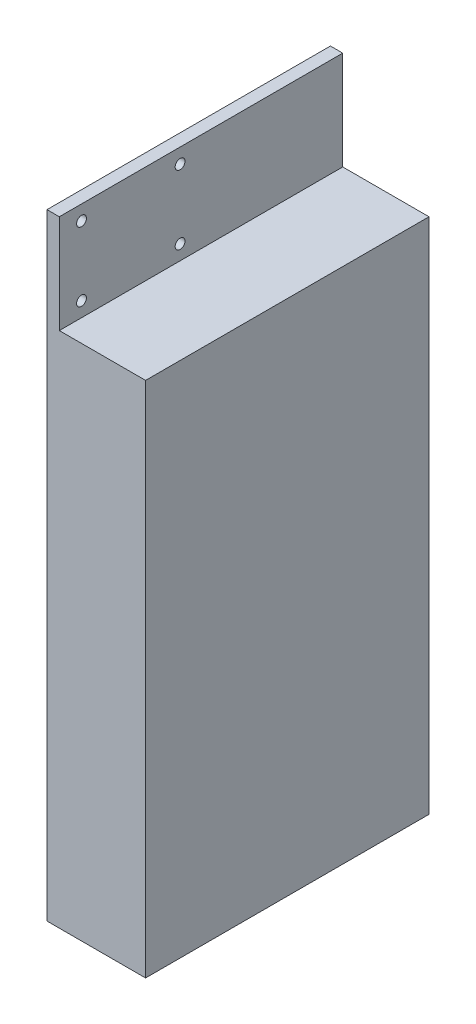
from build123d import *

# Parameters (mm, degrees)
BOSS_EXTRUDE1_DEPTH = 115
SKETCH2_R           = 2
CUT_EXTRUDE1_DEPTH  = 243.744721879


with BuildPart() as part:
    # Sketch1 → Boss-Extrude1 (new body)
    with BuildSketch(Plane.XY):
        Polygon((0, 0), (0, 40), (-5, 40), (-5, -210), (35, -210), (35, 0), align=None)
    extrude(amount=BOSS_EXTRUDE1_DEPTH)

    # Sketch2 → Cut-Extrude1 (cut, through all)
    with BuildSketch(Plane.ZY.offset(5)):
        with Locations((106, 34)):
            Circle(SKETCH2_R)
        with Locations((66, 34)):
            Circle(SKETCH2_R)
        with Locations((66, 6)):
            Circle(SKETCH2_R)
        with Locations((106, 6)):
            Circle(SKETCH2_R)
    extrude(amount=-CUT_EXTRUDE1_DEPTH, mode=Mode.SUBTRACT)


solid = part.part
